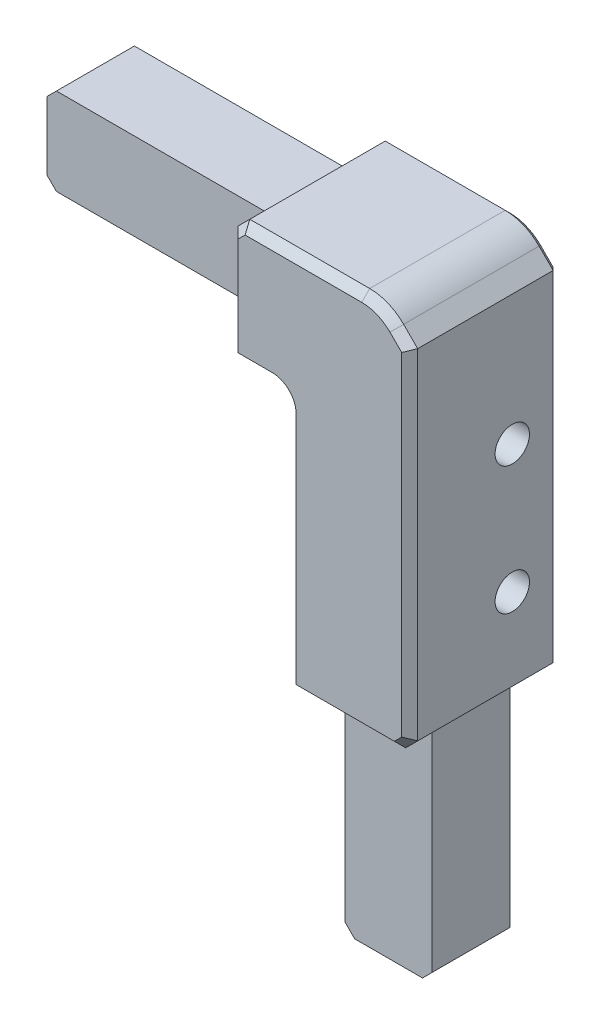
from build123d import *

# Parameters (mm, degrees)
BODY_DEPTH                  = 5.71
SIDE_TONGUE_SKETCH_W        = 10.88
SIDE_TONGUE_SKETCH_H        = 31
SIDE_TONGUE_DEPTH           = 4.875
END_TONGUE_SKETCH_W         = 31
END_TONGUE_SKETCH_H         = 10.88
END_TONGUE_DEPTH            = 4.875
WEB_DEPTH                   = 9.27
LIP_DEPTH                   = 1.985
INSERT_HOLES_SKETCH_R       = 2.15
INSERT_HOLES_DEPTH          = 4.5
BUMPER_CORNER_BED_SIDE_SIZE = 3.516
BUMPER_CORNER_R             = 6
INSIDE_CORNER_OF_THE_WEB_R  = 1
REVEAL_CORNER_R             = 2
BODY_INSIDE_CORNER_R        = 2
ARM_ENDS_SIZE               = 1.5
TONGUE_LEAD_IN_SIZE         = 1.2
FRONT_FACE_CHAMFER_SIZE     = 1
BACK_FACE_CHAMFER_SIZE      = 0.6


with BuildPart() as part:
    # body sketch → body (new, symmetric)
    with BuildSketch(Plane.XY.offset(19.54)):
        Polygon((4.42, 7.07), (-18.08, 7.07), (-18.08, -8.13), (-10.78, -8.13), (-10.78, -40.43), (4.42, -40.43), align=None)
    extrude(amount=BODY_DEPTH, both=True)

    # side tongue sketch → side tongue (add, symmetric)
    with BuildSketch(Plane.XY.offset(20.375)):
        with Locations((-5.34, -54.93)):
            Rectangle(SIDE_TONGUE_SKETCH_W, SIDE_TONGUE_SKETCH_H)
    extrude(amount=SIDE_TONGUE_DEPTH, both=True)

    # end tongue sketch → end tongue (add, symmetric)
    with BuildSketch(Plane.XY.offset(20.375)):
        with Locations((-32.58, -2.69)):
            Rectangle(END_TONGUE_SKETCH_W, END_TONGUE_SKETCH_H)
    extrude(amount=END_TONGUE_DEPTH, both=True)

    # web sketch → web (add, symmetric)
    with BuildSketch(Plane.XY.offset(23.1)):
        Polygon((4.42, 7.07), (-18.08, 7.07), (-18.08, 3), (0.35, 3), (0.35, -40.43), (4.42, -40.43), align=None)
    extrude(amount=WEB_DEPTH, both=True)

    # lip sketch → lip (add, symmetric)
    with BuildSketch(Plane.XY.offset(30.385)):
        Polygon((4.42, 7.07), (-18.08, 7.07), (-18.08, -8.13), (-10.78, -8.13), (-10.78, -40.43), (4.42, -40.43), align=None)
    extrude(amount=LIP_DEPTH, both=True)

    # insert holes sketch → insert holes (cut, symmetric)
    with BuildSketch(Plane(origin=(0.92, 0, 0), x_dir=(0, 0, -1), z_dir=(1, 0, 0))):
        with Locations((-19.54, -28.7)):
            Circle(INSERT_HOLES_SKETCH_R)
        with Locations((-19.54, -12.7)):
            Circle(INSERT_HOLES_SKETCH_R)
    extrude(amount=INSERT_HOLES_DEPTH, both=True, mode=Mode.SUBTRACT)

    # bumper corner, bed side
    bumper_corner_bed_side_edges = [part.edges().sort_by_distance(p)[0] for p in [
        (4.42, 7.07, 23.1),
    ]]
    chamfer(bumper_corner_bed_side_edges, length=BUMPER_CORNER_BED_SIDE_SIZE)

    # bumper corner
    bumper_corner_edges = [part.edges().sort_by_distance(p)[0] for p in [
        (0.904, 7.07, 23.1),
    ]]
    fillet(bumper_corner_edges, radius=BUMPER_CORNER_R)

    # inside corner of the web
    inside_corner_of_the_web_edges = [part.edges().sort_by_distance(p)[0] for p in [
        (0.35, 3, 26.825),
    ]]
    fillet(inside_corner_of_the_web_edges, radius=INSIDE_CORNER_OF_THE_WEB_R)

    # reveal corner
    reveal_corner_edges = [part.edges().sort_by_distance(p)[0] for p in [
        (-10.78, -8.13, 30.385),
    ]]
    fillet(reveal_corner_edges, radius=REVEAL_CORNER_R)

    # body inside corner
    body_inside_corner_edges = [part.edges().sort_by_distance(p)[0] for p in [
        (-10.78, -8.13, 19.54),
    ]]
    fillet(body_inside_corner_edges, radius=BODY_INSIDE_CORNER_R)

    # arm ends
    arm_ends_edges = [part.edges().sort_by_distance(p)[0] for p in [
        (-18.08, 7.07, 23.1),
        (4.42, -40.43, 23.1),
    ]]
    chamfer(arm_ends_edges, length=ARM_ENDS_SIZE)

    # tongue lead-in
    tongue_lead_in_edges = [part.edges().sort_by_distance(p)[0] for p in [
        (-48.08, -8.13, 20.375),
        (-48.08, 2.75, 20.375),
        (-10.78, -70.43, 20.375),
        (0.1, -70.43, 20.375),
    ]]
    chamfer(tongue_lead_in_edges, length=TONGUE_LEAD_IN_SIZE)

    # front face chamfer
    front_face_chamfer_edges = [part.edges().sort_by_distance(p)[0] for p in [
        (0.71481922, 6.613277195, 32.37),
        (3.540679656, 4.433320344, 32.37),
        (4.42, -17.688, 32.37),
        (3.67, -39.68, 32.37),
        (-3.93, -40.43, 32.37),
        (-10.78, -25.28, 32.37),
        (-11.365786438, -8.715786438, 32.37),
        (-15.43, -8.13, 32.37),
        (-18.08, -1.28, 32.37),
        (-17.33, 6.32, 32.37),
        (-9.080640687, 7.07, 32.37),
    ]]
    chamfer(front_face_chamfer_edges, length=FRONT_FACE_CHAMFER_SIZE)

    # back face chamfer
    back_face_chamfer_edges = [part.edges().sort_by_distance(p)[0] for p in [
        (-15.43, -8.13, 13.83),
        (-11.365786438, -8.715786438, 13.83),
        (-10.78, -25.28, 13.83),
        (-3.93, -40.43, 13.83),
        (3.67, -39.68, 13.83),
        (4.42, -17.688, 13.83),
        (3.540679656, 4.433320344, 13.83),
        (0.71481922, 6.613277195, 13.83),
        (-9.080640687, 7.07, 13.83),
        (-17.33, 6.32, 13.83),
        (-18.08, -1.28, 13.83),
    ]]
    chamfer(back_face_chamfer_edges, length=BACK_FACE_CHAMFER_SIZE)


solid = part.part
